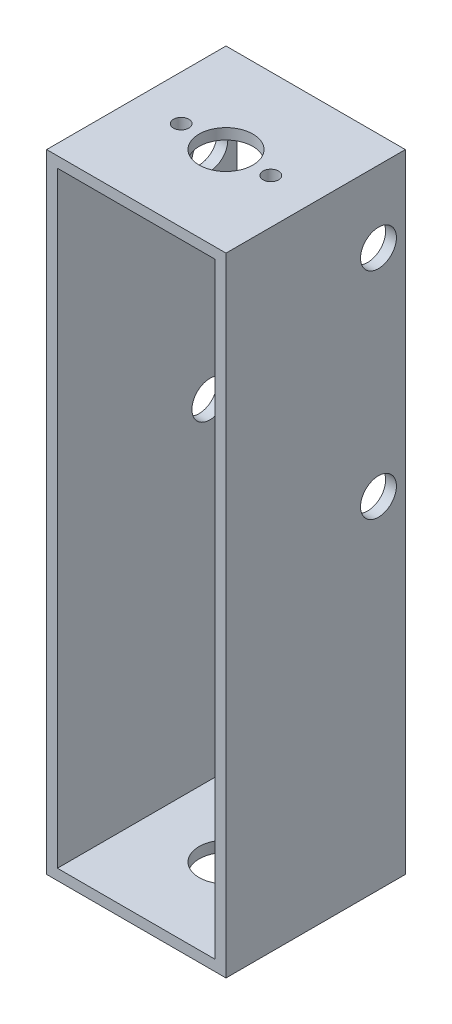
from build123d import *

# Parameters (mm, degrees)
SKETCH1_W           = 50
SKETCH1_H           = 50
BOSS_EXTRUDE1_DEPTH = 175
SHELL1_T            = -3
CUT_EXTRUDE1_REACH  = 180.536
SKETCH2_R           = 7.5
SKETCH2_R_2         = 2.15
SKETCH2_2_R         = 7.5
CUT_EXTRUDE2_DEPTH  = 179.535710714
SKETCH3_R           = 5
CUT_EXTRUDE3_DEPTH  = 184.711730709


with BuildPart() as part:
    # Sketch1 → Boss-Extrude1 (new body)
    with BuildSketch(Plane(origin=(0, 0, 0), x_dir=(1, 0, 0), z_dir=(0, 1, 0))):
        Rectangle(SKETCH1_W, SKETCH1_H)
    extrude(amount=-BOSS_EXTRUDE1_DEPTH)

    # Shell1
    shell1_openings = [part.faces().sort_by_distance(p)[0] for p in [
        (0, -87.5, -25),
        (0, -87.5, 25),
    ]]
    offset(amount=SHELL1_T, openings=shell1_openings, kind=Kind.INTERSECTION)

    # Sketch2 → Cut-Extrude1 (cut, up to next)
    with BuildSketch(Plane(origin=(0, 0, 0), x_dir=(1, 0, 0), z_dir=(0, 1, 0)), mode=Mode.PRIVATE) as cut_extrude1_sk1:
        Circle(SKETCH2_R)
    cut_extrude1_tool1 = extrude(cut_extrude1_sk1.sketch, amount=-CUT_EXTRUDE1_REACH, mode=Mode.PRIVATE) & part.part
    # Sketch2 → Cut-Extrude1 (cut, up to next)
    with BuildSketch(Plane(origin=(0, 0, 0), x_dir=(1, 0, 0), z_dir=(0, 1, 0)), mode=Mode.PRIVATE) as cut_extrude1_sk2:
        with Locations((-12.5, 0)):
            Circle(SKETCH2_R_2)
    cut_extrude1_tool2 = extrude(cut_extrude1_sk2.sketch, amount=-CUT_EXTRUDE1_REACH, mode=Mode.PRIVATE) & part.part
    # Sketch2 → Cut-Extrude1 (cut, up to next)
    with BuildSketch(Plane(origin=(0, 0, 0), x_dir=(1, 0, 0), z_dir=(0, 1, 0)), mode=Mode.PRIVATE) as cut_extrude1_sk3:
        with Locations((12.5, 0)):
            Circle(SKETCH2_R_2)
    cut_extrude1_tool3 = extrude(cut_extrude1_sk3.sketch, amount=-CUT_EXTRUDE1_REACH, mode=Mode.PRIVATE) & part.part
    add(cut_extrude1_tool1.solids().sort_by_distance((0, 0, 0))[0], mode=Mode.SUBTRACT)
    add(cut_extrude1_tool2.solids().sort_by_distance((-12.5, 0, 0))[0], mode=Mode.SUBTRACT)
    add(cut_extrude1_tool3.solids().sort_by_distance((12.5, 0, 0))[0], mode=Mode.SUBTRACT)

    # Sketch2<2> → Cut-Extrude2 (cut, through all)
    with BuildSketch(Plane(origin=(0, 0, 0), x_dir=(1, 0, 0), z_dir=(0, 1, 0))):
        Circle(SKETCH2_2_R)
    extrude(amount=-CUT_EXTRUDE2_DEPTH, mode=Mode.SUBTRACT)

    # Sketch3 → Cut-Extrude3 (cut, through all)
    with BuildSketch(Plane(origin=(25, 0, 0), x_dir=(0, 0, -1), z_dir=(1, 0, 0))):
        with Locations((17.5, -20)):
            Circle(SKETCH3_R)
        with Locations((17.5, -80)):
            Circle(SKETCH3_R)
    extrude(amount=-CUT_EXTRUDE3_DEPTH, mode=Mode.SUBTRACT)


solid = part.part
